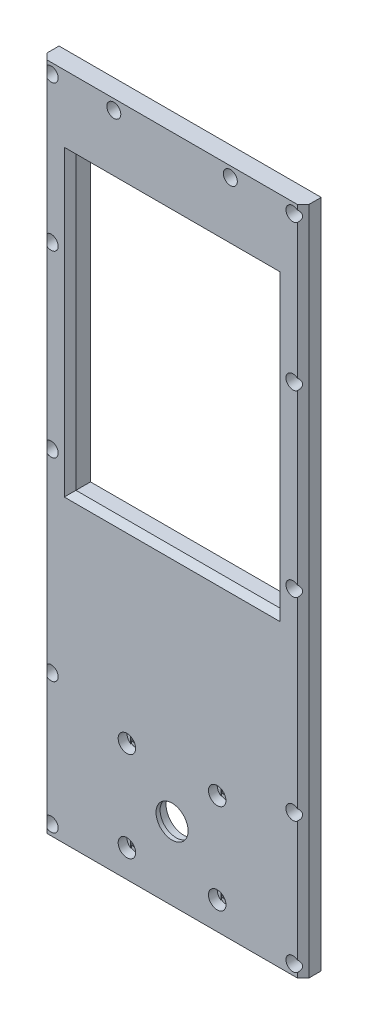
from build123d import *

# Parameters (mm, degrees)
SKETCH1_W           = 90
SKETCH1_H           = 230
SKETCH1_W_2         = 76
SKETCH1_H_2         = 216
BOSS_EXTRUDE1_DEPTH = 7
SKETCH2_W           = 76
SKETCH2_H           = 50
BOSS_EXTRUDE2_DEPTH = 7
SKETCH3_R           = 5.5
CUT_EXTRUDE1_DEPTH  = 124.689126442
SKETCH4_R           = 6.05
CUT_EXTRUDE2_DEPTH  = 5.6
SKETCH5_R           = 12
CUT_EXTRUDE3_DEPTH  = 3
SKETCH6_R           = 1.7
CUT_EXTRUDE4_DEPTH  = 124.689126442
SKETCH7_W           = 60
SKETCH7_H           = 45
CUT_EXTRUDE5_DEPTH  = 1
SKETCH8_R           = 3
CUT_EXTRUDE6_DEPTH  = 3
SKETCH9_R           = 1.45
CUT_EXTRUDE7_DEPTH  = 124.689126442
SKETCH10_R          = 2.4
CUT_EXTRUDE8_DEPTH  = 5
CHAMFER1_SIZE       = 2
SKETCH11_W          = 76
SKETCH11_H          = 21.6
BOSS_EXTRUDE3_DEPTH = 7
SKETCH12_R          = 1.45
CUT_EXTRUDE9_DEPTH  = 124.689126442
SKETCH13_R          = 2.4
CUT_EXTRUDE10_DEPTH = 5
CHAMFER2_SIZE       = 0.8
CUT_EXTRUDE11_DEPTH = 0.2
SKETCH15_W          = 2.9
SKETCH15_H          = 2.9
CUT_EXTRUDE12_DEPTH = 0.2
CUT_EXTRUDE13_DEPTH = 0.2
SKETCH17_W          = 3.4
SKETCH17_H          = 3.4
CUT_EXTRUDE14_DEPTH = 0.2
BOSS_EXTRUDE4_START = -7
SKETCH18_W          = 77.6
SKETCH18_H          = 38
BOSS_EXTRUDE4_DEPTH = 7
CHAMFER3_SIZE       = 0.8
SKETCH19_W          = 77.6
SKETCH19_H          = 108.8
BOSS_EXTRUDE5_DEPTH = 7
CUT_EXTRUDE15_DEPTH = 0.2
SKETCH21_W          = 2.9
SKETCH21_H          = 2.9
CUT_EXTRUDE16_DEPTH = 0.2
SKETCH22_W          = 70
SKETCH22_H          = 100
CUT_EXTRUDE17_DEPTH = 124.689126442
CHAMFER4_SIZE       = 2


with BuildPart() as part:
    # Sketch1 → Boss-Extrude1 (new body)
    with BuildSketch(Plane.XY):
        Rectangle(SKETCH1_W, SKETCH1_H)
        Rectangle(SKETCH1_W_2, SKETCH1_H_2, mode=Mode.SUBTRACT)
    extrude(amount=BOSS_EXTRUDE1_DEPTH)

    # Sketch2 → Boss-Extrude2 (add)
    with BuildSketch(Plane.XY.offset(7)):
        with Locations((0, -83)):
            Rectangle(SKETCH2_W, SKETCH2_H)
    extrude(amount=-BOSS_EXTRUDE2_DEPTH)

    # Sketch3 → Cut-Extrude1 (cut, through all)
    with BuildSketch(Plane(origin=(0, 0, 0), x_dir=(-1, 0, 0), z_dir=(0, 0, -1))):
        with Locations((0, -90)):
            Circle(SKETCH3_R)
    extrude(amount=-CUT_EXTRUDE1_DEPTH, mode=Mode.SUBTRACT)

    # Sketch4 → Cut-Extrude2 (cut)
    with BuildSketch(Plane(origin=(0, 0, 0), x_dir=(-1, 0, 0), z_dir=(0, 0, -1))):
        with Locations((0, -90)):
            Circle(SKETCH4_R)
    extrude(amount=-CUT_EXTRUDE2_DEPTH, mode=Mode.SUBTRACT)

    # Sketch5 → Cut-Extrude3 (cut)
    with BuildSketch(Plane(origin=(0, 0, 0), x_dir=(-1, 0, 0), z_dir=(0, 0, -1))):
        with Locations((0, -90)):
            Circle(SKETCH5_R)
    extrude(amount=-CUT_EXTRUDE3_DEPTH, mode=Mode.SUBTRACT)

    # Sketch6 → Cut-Extrude4 (cut, through all)
    with BuildSketch(Plane(origin=(0, 0, 0), x_dir=(-1, 0, 0), z_dir=(0, 0, -1))):
        with Locations((-15.5, -74.5)):
            Circle(SKETCH6_R)
        with Locations((15.5, -74.5)):
            Circle(SKETCH6_R)
        with Locations((15.5, -105.5)):
            Circle(SKETCH6_R)
        with Locations((-15.5, -105.5)):
            Circle(SKETCH6_R)
    extrude(amount=-CUT_EXTRUDE4_DEPTH, mode=Mode.SUBTRACT)

    # Sketch7 → Cut-Extrude5 (cut)
    with BuildSketch(Plane(origin=(0, 0, 0), x_dir=(-1, 0, 0), z_dir=(0, 0, -1))):
        with Locations((0, -90)):
            Rectangle(SKETCH7_W, SKETCH7_H)
    extrude(amount=-CUT_EXTRUDE5_DEPTH, mode=Mode.SUBTRACT)

    # Sketch8 → Cut-Extrude6 (cut)
    with BuildSketch(Plane.XY.offset(7)):
        with Locations((-15.5, -74.5)):
            Circle(SKETCH8_R)
        with Locations((15.5, -74.5)):
            Circle(SKETCH8_R)
        with Locations((15.5, -105.5)):
            Circle(SKETCH8_R)
        with Locations((-15.5, -105.5)):
            Circle(SKETCH8_R)
    extrude(amount=-CUT_EXTRUDE6_DEPTH, mode=Mode.SUBTRACT)

    # Sketch9 → Cut-Extrude7 (cut, through all)
    with BuildSketch(Plane.XY.offset(7)):
        with Locations((-41.5, 111.5)):
            Circle(SKETCH9_R)
        with Locations((41.5, 111.5)):
            Circle(SKETCH9_R)
        with Locations((-41.5, -111.5)):
            Circle(SKETCH9_R)
        with Locations((41.5, -111.5)):
            Circle(SKETCH9_R)
        with Locations((-41.5, 61.5)):
            Circle(SKETCH9_R)
        with Locations((41.5, 61.5)):
            Circle(SKETCH9_R)
        with Locations((41.5, -66.5)):
            Circle(SKETCH9_R)
        with Locations((-41.5, -66.5)):
            Circle(SKETCH9_R)
        with Locations((-41.5, 0)):
            Circle(SKETCH9_R)
        with Locations((41.5, 0)):
            Circle(SKETCH9_R)
    extrude(amount=-CUT_EXTRUDE7_DEPTH, mode=Mode.SUBTRACT)

    # Sketch10 → Cut-Extrude8 (cut)
    with BuildSketch(Plane.XY.offset(7)):
        with Locations((-41.5, 111.5)):
            Circle(SKETCH10_R)
        with Locations((41.5, 61.5)):
            Circle(SKETCH10_R)
        with Locations((-41.5, 61.5)):
            Circle(SKETCH10_R)
        with Locations((41.5, 111.5)):
            Circle(SKETCH10_R)
        with Locations((-41.5, -111.5)):
            Circle(SKETCH10_R)
        with Locations((41.5, -111.5)):
            Circle(SKETCH10_R)
        with Locations((-41.5, -66.5)):
            Circle(SKETCH10_R)
        with Locations((41.5, -66.5)):
            Circle(SKETCH10_R)
        with Locations((-41.5, 0)):
            Circle(SKETCH10_R)
        with Locations((41.5, 0)):
            Circle(SKETCH10_R)
    extrude(amount=-CUT_EXTRUDE8_DEPTH, mode=Mode.SUBTRACT)

    # Chamfer1
    # the kernel refuses this chamfer: 2 mm, written as the material it takes off along each edge
    with BuildSketch(Plane(origin=(-45, 120.143365976, 7), x_dir=(-0.027495876610585623, 0, -0.9996219169112968), z_dir=(0, -1, 0)), Plane(origin=(45, -120.143365976, 7), x_dir=(0.027495876610585623, 0, -0.9996219169112968), z_dir=(0, 1, 0))) as chamfer1_piece_1:
        Polygon((CHAMFER1_SIZE * 0.999621916911, CHAMFER1_SIZE * 0.0274958766106), (-CHAMFER1_SIZE * 0.0274958766106, CHAMFER1_SIZE * 0.999621916911), (0, 0), align=None)
    extrude(amount=240.286731952, mode=Mode.SUBTRACT)

    # Sketch11 → Boss-Extrude3 (add)
    with BuildSketch(Plane.XY.offset(7)):
        with Locations((0, -47.2)):
            Rectangle(SKETCH11_W, SKETCH11_H)
    extrude(amount=-BOSS_EXTRUDE3_DEPTH)

    # Sketch12 → Cut-Extrude9 (cut, through all)
    with BuildSketch(Plane.XY.offset(7)):
        with Locations((-20, 111.5)):
            Circle(SKETCH12_R)
        with Locations((20, 111.5)):
            Circle(SKETCH12_R)
    extrude(amount=-CUT_EXTRUDE9_DEPTH, mode=Mode.SUBTRACT)

    # Sketch13 → Cut-Extrude10 (cut)
    with BuildSketch(Plane.XY.offset(7)):
        with Locations((-20, 111.5)):
            Circle(SKETCH13_R)
        with Locations((20, 111.5)):
            Circle(SKETCH13_R)
    extrude(amount=-CUT_EXTRUDE10_DEPTH, mode=Mode.SUBTRACT)

    # Chamfer2
    chamfer2_edges = [part.edges().sort_by_distance(p)[0] for p in [
        (0, 108, 0),
        (-38, 35.8, 0),
        (0, 108, 7),
        (-38, 35.8, 7),
        (38, 35.8, 7),
        (38, 35.8, 0),
        (0, -36.4, 7),
        (0, -36.4, 0),
        (0, -115, 0),
        (-45, 0, 0),
        (0, 115, 0),
        (45, 0, 0),
    ]]
    chamfer(chamfer2_edges, length=CHAMFER2_SIZE)

    # Sketch14 → Cut-Extrude11 (cut)
    with BuildSketch(Plane.XY.offset(2)):
        with BuildLine():
            Line((-42.95, -68.41245915), (-42.95, -64.58754085))
            ThreePointArc((-42.95, -64.58754085), (-41.5, -64.1), (-40.05, -64.58754085))
            Line((-40.05, -64.58754085), (-40.05, -68.41245915))
            ThreePointArc((-40.05, -68.41245915), (-41.5, -68.9), (-42.95, -68.41245915))
        make_face()
        with BuildLine():
            Line((-42.95, -113.41245915), (-42.95, -109.58754085))
            ThreePointArc((-42.95, -109.58754085), (-41.5, -109.1), (-40.05, -109.58754085))
            Line((-40.05, -109.58754085), (-40.05, -113.41245915))
            ThreePointArc((-40.05, -113.41245915), (-41.5, -113.9), (-42.95, -113.41245915))
        make_face()
        with BuildLine():
            Line((-42.95, 59.58754085), (-42.95, 63.41245915))
            ThreePointArc((-42.95, 63.41245915), (-41.5, 63.9), (-40.05, 63.41245915))
            Line((-40.05, 63.41245915), (-40.05, 59.58754085))
            ThreePointArc((-40.05, 59.58754085), (-41.5, 59.1), (-42.95, 59.58754085))
        make_face()
        with BuildLine():
            Line((-21.45, 109.58754085), (-21.45, 113.41245915))
            ThreePointArc((-21.45, 113.41245915), (-20, 113.9), (-18.55, 113.41245915))
            Line((-18.55, 113.41245915), (-18.55, 109.58754085))
            ThreePointArc((-18.55, 109.58754085), (-20, 109.1), (-21.45, 109.58754085))
        make_face()
        with BuildLine():
            Line((-42.95, 109.58754085), (-42.95, 113.41245915))
            ThreePointArc((-42.95, 113.41245915), (-41.5, 113.9), (-40.05, 113.41245915))
            Line((-40.05, 113.41245915), (-40.05, 109.58754085))
            ThreePointArc((-40.05, 109.58754085), (-41.5, 109.1), (-42.95, 109.58754085))
        make_face()
    cut_extrude11 = extrude(amount=-CUT_EXTRUDE11_DEPTH, mode=Mode.SUBTRACT)

    # Sketch15 → Cut-Extrude12 (cut)
    with BuildSketch(Plane.XY.offset(1.8)):
        with Locations((-41.5, -111.5)):
            Rectangle(SKETCH15_W, SKETCH15_H)
        with Locations((-41.5, -66.5)):
            Rectangle(SKETCH15_W, SKETCH15_H)
        with Locations((-41.5, 61.5)):
            Rectangle(SKETCH15_W, SKETCH15_H)
        with Locations((-41.5, 111.5)):
            Rectangle(SKETCH15_W, SKETCH15_H)
        with Locations((-20, 111.5)):
            Rectangle(SKETCH15_W, SKETCH15_H)
    cut_extrude12 = extrude(amount=-CUT_EXTRUDE12_DEPTH, mode=Mode.SUBTRACT)

    # Sketch16 → Cut-Extrude13 (cut)
    with BuildSketch(Plane.XY.offset(4)):
        with BuildLine():
            Line((-17.2, -76.971841419), (-17.2, -72.028158581))
            ThreePointArc((-17.2, -72.028158581), (-15.5, -71.5), (-13.8, -72.028158581))
            Line((-13.8, -72.028158581), (-13.8, -76.971841419))
            ThreePointArc((-13.8, -76.971841419), (-15.5, -77.5), (-17.2, -76.971841419))
        make_face()
        with BuildLine():
            Line((-17.2, -107.971841419), (-17.2, -103.028158581))
            ThreePointArc((-17.2, -103.028158581), (-15.5, -102.5), (-13.8, -103.028158581))
            Line((-13.8, -103.028158581), (-13.8, -107.971841419))
            ThreePointArc((-13.8, -107.971841419), (-15.5, -108.5), (-17.2, -107.971841419))
        make_face()
    cut_extrude13 = extrude(amount=-CUT_EXTRUDE13_DEPTH, mode=Mode.SUBTRACT)

    # Sketch17 → Cut-Extrude14 (cut)
    with BuildSketch(Plane.XY.offset(3.8)):
        with Locations((-15.5, -74.5)):
            Rectangle(SKETCH17_W, SKETCH17_H)
        with Locations((-15.5, -105.5)):
            Rectangle(SKETCH17_W, SKETCH17_H)
    cut_extrude14 = extrude(amount=-CUT_EXTRUDE14_DEPTH, mode=Mode.SUBTRACT)

    # Mirror1: Cut-Extrude11, Cut-Extrude12, Cut-Extrude13, Cut-Extrude14 across plane
    add(cut_extrude11.mirror(Plane(origin=(0, 0, 0), x_dir=(0, 0, 1), z_dir=(1, 0, 0))), mode=Mode.SUBTRACT)
    add(cut_extrude12.mirror(Plane(origin=(0, 0, 0), x_dir=(0, 0, 1), z_dir=(1, 0, 0))), mode=Mode.SUBTRACT)
    add(cut_extrude13.mirror(Plane(origin=(0, 0, 0), x_dir=(0, 0, 1), z_dir=(1, 0, 0))), mode=Mode.SUBTRACT)
    add(cut_extrude14.mirror(Plane(origin=(0, 0, 0), x_dir=(0, 0, 1), z_dir=(1, 0, 0))), mode=Mode.SUBTRACT)

    # Sketch18 → Boss-Extrude4 (add)
    with BuildSketch(Plane.XY.offset(7).offset(BOSS_EXTRUDE4_START)):
        with Locations((0, 89.8)):
            Rectangle(SKETCH18_W, SKETCH18_H)
    extrude(amount=BOSS_EXTRUDE4_DEPTH)

    # Chamfer3
    chamfer3_edges = [part.edges().sort_by_distance(p)[0] for p in [
        (0, 70.8, 7),
    ]]
    chamfer(chamfer3_edges, length=CHAMFER3_SIZE)

    # Sketch19 → Boss-Extrude5 (add)
    with BuildSketch(Plane.XY.offset(7)):
        with Locations((0, 17.2)):
            Rectangle(SKETCH19_W, SKETCH19_H)
    extrude(amount=-BOSS_EXTRUDE5_DEPTH)

    # Sketch20 → Cut-Extrude15 (cut)
    with BuildSketch(Plane.XY.offset(2)):
        with BuildLine():
            Line((-42.95, -1.91245915), (-42.95, 1.91245915))
            ThreePointArc((-42.95, 1.91245915), (-41.5, 2.4), (-40.05, 1.91245915))
            Line((-40.05, 1.91245915), (-40.05, -1.91245915))
            ThreePointArc((-40.05, -1.91245915), (-41.5, -2.4), (-42.95, -1.91245915))
        make_face()
    cut_extrude15 = extrude(amount=-CUT_EXTRUDE15_DEPTH, mode=Mode.SUBTRACT)

    # Sketch21 → Cut-Extrude16 (cut)
    with BuildSketch(Plane.XY.offset(1.8)):
        with Locations((-41.5, 0)):
            Rectangle(SKETCH21_W, SKETCH21_H)
    cut_extrude16 = extrude(amount=-CUT_EXTRUDE16_DEPTH, mode=Mode.SUBTRACT)

    # Mirror2: Cut-Extrude15, Cut-Extrude16 across plane
    add(cut_extrude15.mirror(Plane(origin=(0, 0, 0), x_dir=(0, 0, 1), z_dir=(1, 0, 0))), mode=Mode.SUBTRACT)
    add(cut_extrude16.mirror(Plane(origin=(0, 0, 0), x_dir=(0, 0, 1), z_dir=(1, 0, 0))), mode=Mode.SUBTRACT)

    # Sketch22 → Cut-Extrude17 (cut, through all)
    with BuildSketch(Plane.XY.offset(7)):
        with Locations((0, 40)):
            Rectangle(SKETCH22_W, SKETCH22_H)
    extrude(amount=-CUT_EXTRUDE17_DEPTH, mode=Mode.SUBTRACT)

    # Chamfer4
    chamfer4_edges = [part.edges().sort_by_distance(p)[0] for p in [
        (35, 40, 7),
        (0, 90, 7),
        (-35, 40, 7),
        (0, -10, 7),
    ]]
    chamfer(chamfer4_edges, length=CHAMFER4_SIZE)


solid = part.part
